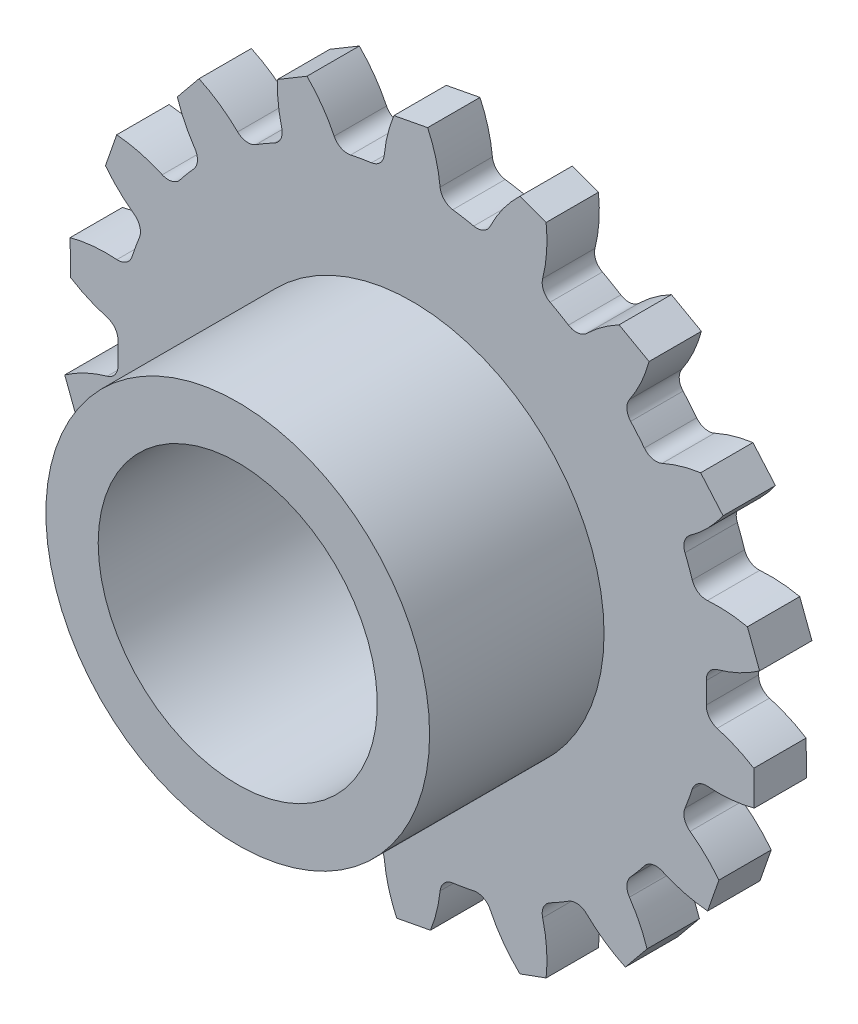
from build123d import *

# Parameters (mm, degrees)
EXTRUDE_1_DEPTH         = 3
SKETCH_2_W              = 11
SKETCH_2_H              = 10
HOLE_WIZARD_16_0_16_1_D = 16
FILLET_1_R              = 0.85


with BuildPart() as part:
    # 草图1 → 凸台-拉伸1 (new body)
    with BuildSketch(Plane.XY.offset(3)):
        with BuildLine():
            Line((7.677617845, 18.755038144), (6.174109651, 19.302270373))
            ThreePointArc((6.174109651, 19.302270373), (5.023989627, 17.932407977), (4.203345275, 16.343118231))
            ThreePointArc((4.203345275, 16.343118231), (2.930312998, 16.618630832), (1.639823102, 16.795136355))
            ThreePointArc((1.639823102, 16.795136355), (1.197968963, 19.299137818), (0, 21.541932676))
            ThreePointArc((0, 21.541932676), (-1.197968963, 19.299137818), (-1.639823102, 16.795136355))
            ThreePointArc((-1.639823102, 16.795136355), (-2.930312998, 16.618630832), (-4.203345275, 16.343118231))
            ThreePointArc((-4.203345275, 16.343118231), (-5.474971289, 18.544986912), (-7.367774901, 20.242795173))
            ThreePointArc((-7.367774901, 20.242795173), (-7.726416477, 17.725527879), (-7.285204612, 15.221413166))
            ThreePointArc((-7.285204612, 15.221413166), (-8.4375, 14.614178689), (-9.539528177, 13.919878849))
            ThreePointArc((-9.539528177, 13.919878849), (-11.4875492, 15.554036889), (-13.846887413, 16.50207782))
            ThreePointArc((-13.846887413, 16.50207782), (-13.322944134, 14.013957677), (-12.051882927, 11.811762904))
            ThreePointArc((-12.051882927, 11.811762904), (-12.926999978, 10.847040913), (-13.725103193, 9.817696642))
            ThreePointArc((-13.725103193, 9.817696642), (-16.114559141, 10.687040464), (-18.655860944, 10.770966338))
            ThreePointArc((-18.655860944, 10.770966338), (-17.312528103, 8.612097355), (-15.364926295, 6.977439714))
            ThreePointArc((-15.364926295, 6.977439714), (-15.857312976, 5.771589919), (-16.255228202, 4.531355326))
            ThreePointArc((-16.255228202, 4.531355326), (-18.797915423, 4.531029235), (-21.214662314, 3.740717353))
            ThreePointArc((-21.214662314, 3.740717353), (-19.213965677, 2.17149099), (-16.824732789, 1.301534317))
            ThreePointArc((-16.824732789, 1.301534317), (-16.875, 0), (-16.824732789, -1.301534317))
            ThreePointArc((-16.824732789, -1.301534317), (-19.213965677, -2.17149099), (-21.214662314, -3.740717353))
            ThreePointArc((-21.214662314, -3.740717353), (-18.797915423, -4.531029235), (-16.255228202, -4.531355326))
            ThreePointArc((-16.255228202, -4.531355326), (-15.857312976, -5.771589919), (-15.364926295, -6.977439714))
            ThreePointArc((-15.364926295, -6.977439714), (-17.312528103, -8.612097355), (-18.655860944, -10.770966338))
            ThreePointArc((-18.655860944, -10.770966338), (-16.114559141, -10.687040464), (-13.725103193, -9.817696642))
            ThreePointArc((-13.725103193, -9.817696642), (-12.926999978, -10.847040913), (-12.051882927, -11.811762904))
            ThreePointArc((-12.051882927, -11.811762904), (-13.322944134, -14.013957677), (-13.846887413, -16.50207782))
            ThreePointArc((-13.846887413, -16.50207782), (-11.4875492, -15.554036889), (-9.539528177, -13.919878849))
            ThreePointArc((-9.539528177, -13.919878849), (-8.4375, -14.614178689), (-7.285204612, -15.221413166))
            ThreePointArc((-7.285204612, -15.221413166), (-7.726416477, -17.725527879), (-7.367774901, -20.242795173))
            ThreePointArc((-7.367774901, -20.242795173), (-5.474971289, -18.544986912), (-4.203345275, -16.343118231))
            ThreePointArc((-4.203345275, -16.343118231), (-2.930312998, -16.618630832), (-1.639823102, -16.795136355))
            ThreePointArc((-1.639823102, -16.795136355), (-1.197968963, -19.299137818), (0, -21.541932676))
            ThreePointArc((0, -21.541932676), (1.197968963, -19.299137818), (1.639823102, -16.795136355))
            ThreePointArc((1.639823102, -16.795136355), (2.930312998, -16.618630832), (4.203345275, -16.343118231))
            ThreePointArc((4.203345275, -16.343118231), (5.023989627, -17.932407977), (6.174109651, -19.302270373))
            Line((6.174109651, -19.302270373), (7.677617845, -18.755038144))
            ThreePointArc((7.677617845, -18.755038144), (7.678130324, -16.966379766), (7.285204612, -15.221413166))
            ThreePointArc((7.285204612, -15.221413166), (8.4375, -14.614178689), (9.539528177, -13.919878849))
            ThreePointArc((9.539528177, -13.919878849), (11.4875492, -15.554036889), (13.846887413, -16.50207782))
            ThreePointArc((13.846887413, -16.50207782), (13.322944134, -14.013957677), (12.051882927, -11.811762904))
            ThreePointArc((12.051882927, -11.811762904), (12.926999978, -10.847040913), (13.725103193, -9.817696642))
            ThreePointArc((13.725103193, -9.817696642), (16.114559141, -10.687040464), (18.655860944, -10.770966338))
            ThreePointArc((18.655860944, -10.770966338), (17.312528103, -8.612097355), (15.364926295, -6.977439714))
            ThreePointArc((15.364926295, -6.977439714), (15.857312976, -5.771589919), (16.255228202, -4.531355326))
            ThreePointArc((16.255228202, -4.531355326), (18.797915423, -4.531029235), (21.214662314, -3.740717353))
            ThreePointArc((21.214662314, -3.740717353), (19.213965677, -2.17149099), (16.824732789, -1.301534317))
            ThreePointArc((16.824732789, -1.301534317), (16.875, 0), (16.824732789, 1.301534317))
            ThreePointArc((16.824732789, 1.301534317), (19.213965677, 2.17149099), (21.214662314, 3.740717353))
            ThreePointArc((21.214662314, 3.740717353), (18.797915423, 4.531029235), (16.255228202, 4.531355326))
            ThreePointArc((16.255228202, 4.531355326), (15.857312976, 5.771589919), (15.364926295, 6.977439714))
            ThreePointArc((15.364926295, 6.977439714), (17.312528103, 8.612097355), (18.655860944, 10.770966338))
            ThreePointArc((18.655860944, 10.770966338), (16.114559141, 10.687040464), (13.725103193, 9.817696642))
            ThreePointArc((13.725103193, 9.817696642), (12.926999978, 10.847040913), (12.051882927, 11.811762904))
            ThreePointArc((12.051882927, 11.811762904), (13.322944134, 14.013957677), (13.846887413, 16.50207782))
            ThreePointArc((13.846887413, 16.50207782), (11.4875492, 15.554036889), (9.539528177, 13.919878849))
            ThreePointArc((9.539528177, 13.919878849), (8.4375, 14.614178689), (7.285204612, 15.221413166))
            ThreePointArc((7.285204612, 15.221413166), (7.678130324, 16.966379766), (7.677617845, 18.755038144))
        make_face()
    extrude(amount=-EXTRUDE_1_DEPTH)

    # 草图2 → 旋转1 (revolve)
    with BuildSketch(Plane(origin=(0, 0, 0), x_dir=(1, 0, 0), z_dir=(0, 1, 0))):
        with Locations((5.5, -8)):
            Rectangle(SKETCH_2_W, SKETCH_2_H)
    revolve(axis=Axis((0, 0, 3), (0, 0, 1)))

    # Ø16.0 (16) 直径孔1 (through all)
    with Locations(Plane(origin=(0, 0, 0), x_dir=(-1, 0, 0), z_dir=(0, 0, -1))):
        with Locations((0, 0)):
            Hole(HOLE_WIZARD_16_0_16_1_D / 2)

    # 倒角1
    # the kernel refuses this chamfer: 2.4092894, 1.801151222 mm, written as the material it takes off along each edge
    with BuildSketch(Plane(origin=(21.214662314, 3.740717353, 8.457999089), x_dir=(-0.9419139002762257, 0.33585443940259097, 0), z_dir=(0, 0, -1)), Plane(origin=(21.214662314, -3.740717353, 8.457999089), x_dir=(-0.7702405580042077, 0.6377534655377162, 0), z_dir=(0, 0, -1)), Plane(origin=(18.655860944, -10.770966338, 8.457999089), x_dir=(-0.5056648368969275, 0.8627300114902714, 0), z_dir=(0, 0, -1)), Plane(origin=(13.846887413, -16.50207782, 8.457999089), x_dir=(-0.18009847364168569, 0.9836485855181895, 0), z_dir=(0, 0, -1)), Plane(origin=(0, -21.541932676, 8.457999089), x_dir=(0.4943136881093548, 0.8692836002983879, 0), z_dir=(0, 0, -1)), Plane(origin=(-7.367774901, -20.242795173, 8.457999089), x_dir=(0.7618154266345339, 0.6477941461156027, 0), z_dir=(0, 0, -1)), Plane(origin=(-13.846887413, -16.50207782, 8.457999089), x_dir=(0.9374309815093264, 0.3481711574878957, 0), z_dir=(0, 0, -1)), Plane(origin=(18.655860944, 10.770966338, 8.457999089), x_dir=(-0.9999785250062793, -0.00655358880811246, 0), z_dir=(0, 0, -1))) as chamfer_1_piece_1:
        with BuildLine():
            Line((2.119488029, 0), (0.84248532, -1.499732591))
            ThreePointArc((0.84248532, -1.499732591), (0.389416714, -0.786885265), (0, 0))
            ThreePointArc((0, 0), (1.091111326, 0.069719636), (2.119488029, 0))
        make_face()
    extrude(amount=13.915998179, mode=Mode.SUBTRACT)
    with BuildSketch(Plane(origin=(-18.655860944, -10.770966338, 8.457999089), x_dir=(0.48404481309239716, 0.8750432097435796, 0), z_dir=(0, 0, -1)), Plane(origin=(-21.214662314, -3.740717353, 8.457999089), x_dir=(0.7541357430052743, 0.6567185707149471, 0), z_dir=(0, 0, -1)), Plane(origin=(-21.214662314, 3.740717353, 8.457999089), x_dir=(0.9332667724535083, 0.35918397992423245, 0), z_dir=(0, 0, -1)), Plane(origin=(-18.655860944, 10.770966338, 8.457999089), x_dir=(0.9998320555932133, 0.01832650016368515, 0), z_dir=(0, 0, -1)), Plane(origin=(-13.846887413, 16.50207782, 8.457999089), x_dir=(0.9458028368787899, -0.32474142598694317, 0), z_dir=(0, 0, -1)), Plane(origin=(-7.367774901, 20.242795173, 8.457999089), x_dir=(0.777695837473541, -0.6286407434905311, 0), z_dir=(0, 0, -1)), Plane(origin=(0, 21.541932676, 8.457999089), x_dir=(0.5157872425008245, -0.8567167095798913, 0), z_dir=(0, 0, -1)), Plane(origin=(13.846887413, 16.50207782, 8.457999089), x_dir=(-0.15557093497995983, -0.9878247234147671, 0), z_dir=(0, 0, -1))) as chamfer_1_piece_2:
        with BuildLine():
            Line((1.72016841, 0), (1.038059727, 1.847880275))
            ThreePointArc((1.038059727, 1.847880275), (0.473607386, 0.985434319), (0, 0))
            ThreePointArc((0, 0), (0.87677191, -0.045878267), (1.72016841, 0))
        make_face()
    extrude(amount=13.915998179, mode=Mode.SUBTRACT)

    # 圆角1
    fillet_1_edges = [part.edges().sort_by_distance(p)[0] for p in [
        (16.824732789, 1.301534317, 1.5),
        (16.824732789, -1.301534317, 1.5),
        (16.255228202, -4.531355326, 1.5),
        (15.364926295, -6.977439714, 1.5),
        (13.725103193, -9.817696642, 1.5),
        (12.051882927, -11.811762904, 1.5),
        (9.539528177, -13.919878849, 1.5),
        (7.285204612, -15.221413166, 1.5),
        (4.203345275, -16.343118231, 1.5),
        (1.639823102, -16.795136355, 1.5),
        (-1.639823102, -16.795136355, 1.5),
        (-4.203345275, -16.343118231, 1.5),
        (-7.285204612, -15.221413166, 1.5),
        (-9.539528177, -13.919878849, 1.5),
        (-12.051882927, -11.811762904, 1.5),
        (-13.725103193, -9.817696642, 1.5),
        (-15.364926295, -6.977439714, 1.5),
        (-16.255228202, -4.531355326, 1.5),
        (-16.824732789, -1.301534317, 1.5),
        (-16.824732789, 1.301534317, 1.5),
        (-16.255228202, 4.531355326, 1.5),
        (-15.364926295, 6.977439714, 1.5),
        (-13.725103193, 9.817696642, 1.5),
        (-12.051882927, 11.811762904, 1.5),
        (-9.539528177, 13.919878849, 1.5),
        (-7.285204612, 15.221413166, 1.5),
        (-4.203345275, 16.343118231, 1.5),
        (-1.639823102, 16.795136355, 1.5),
        (1.639823102, 16.795136355, 1.5),
        (4.203345275, 16.343118231, 1.5),
        (7.285204612, 15.221413166, 1.5),
        (9.539528177, 13.919878849, 1.5),
        (12.051882927, 11.811762904, 1.5),
        (13.725103193, 9.817696642, 1.5),
        (15.364926295, 6.977439714, 1.5),
        (16.255228202, 4.531355326, 1.5),
    ]]
    fillet(fillet_1_edges, radius=FILLET_1_R)


solid = part.part
